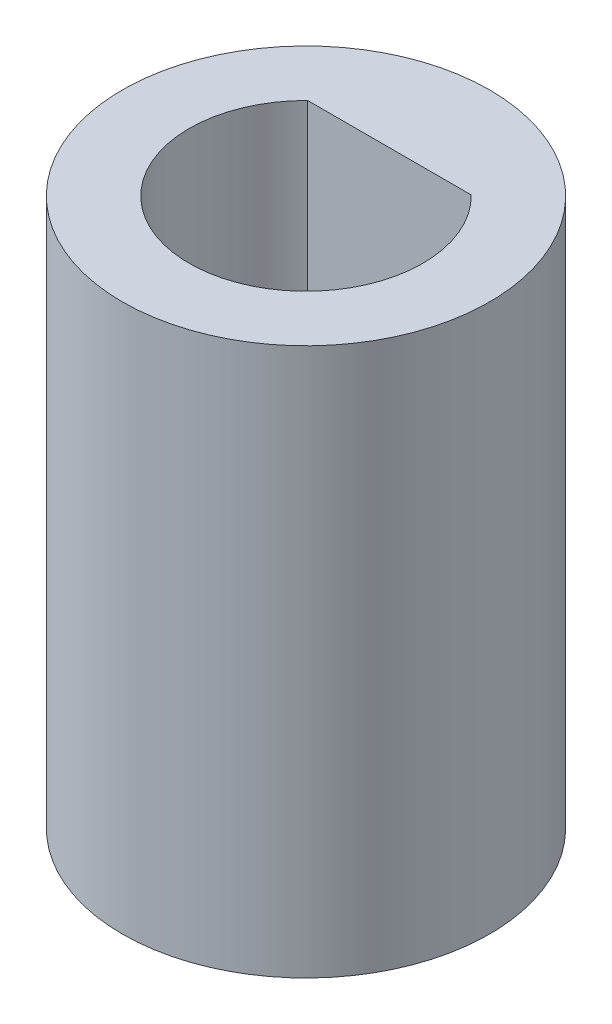
from build123d import *

# Parameters (mm, degrees)
SKETCH1_R           = 5.5
BOSS_EXTRUDE1_DEPTH = 16.4
CUT_EXTRUDE1_DEPTH  = 19.151033028


with BuildPart() as part:
    # Sketch1 → Boss-Extrude1 (new body)
    with BuildSketch(Plane(origin=(0, 0, 0), x_dir=(1, 0, 0), z_dir=(0, 1, 0))):
        Circle(SKETCH1_R)
    extrude(amount=-BOSS_EXTRUDE1_DEPTH)

    # Sketch3 → Cut-Extrude1 (cut, through all)
    with BuildSketch(Plane(origin=(0, 0, 0), x_dir=(1, 0, 0), z_dir=(0, 1, 0))):
        with BuildLine():
            Line((-2.449489743, 2.5), (2.449489743, 2.5))
            ThreePointArc((2.449489743, 2.5), (0, -3.5), (-2.449489743, 2.5))
        make_face()
    extrude(amount=-CUT_EXTRUDE1_DEPTH, mode=Mode.SUBTRACT)


solid = part.part
